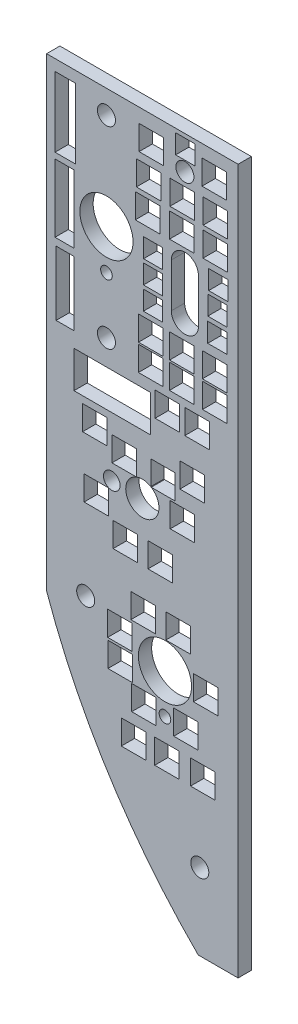
from build123d import *

# Parameters (mm, degrees)
BOSS_EXTRUDE1_DEPTH             = 3.175
F_1_2_0_5_DIAMETER_HOLE1_D      = 12.7
F_5_16_0_3125_DIAMETER_HOLE1_D  = 7.9375
F_5_32_0_15625_DIAMETER_HOLE1_D = 3.96875
F_7_64_0_10938_DIAMETER_HOLE1_D = 2.778252
F_6_CLEARANCE_HOLE1_D           = 4.3053
F_16_0_177_DIAMETER_HOLE1_D     = 4.4958
SKETCH16_W                      = 5.842
SKETCH16_H                      = 5.842
SKETCH16_W_2                    = 4.23392063
SKETCH16_H_2                    = 15.366349947
SKETCH16_W_3                    = 4.5021552
SKETCH16_H_3                    = 16.206338068
SKETCH16_W_4                    = 4.860523654
SKETCH16_H_4                    = 16.706116904
SKETCH16_W_5                    = 18.315310239
SKETCH16_H_5                    = 8.772069641
SKETCH16_W_6                    = 4.572
SKETCH16_H_6                    = 4.572
CUT_EXTRUDE5_DEPTH              = 149.577510685


with BuildPart() as part:
    # Sketch1 → Boss-Extrude1 (new body)
    with BuildSketch(Plane.XY):
        with BuildLine():
            Line((-45.72, 26.9875), (-45.72, -84.1375))
            ThreePointArc((-45.72, -84.1375), (-30.833523511, -114.746148224), (-9.525, -141.2875))
            Line((-9.525, -141.2875), (0, -141.2875))
            Line((0, -141.2875), (0, 26.9875))
            Line((0, 26.9875), (-45.72, 26.9875))
        make_face()
    extrude(amount=-BOSS_EXTRUDE1_DEPTH)

    # 1/2 (0.5) Diameter Hole1 (through all)
    with Locations(Plane.XY):
        with Locations((-17.4625, -86.5505), (-31.4325, -1.620345612)):
            Hole(F_1_2_0_5_DIAMETER_HOLE1_D / 2)

    # 5/16 (0.3125) Diameter Hole1 (through all)
    with Locations(Plane.XY):
        with Locations((-22.86, -53.5305)):
            Hole(F_5_16_0_3125_DIAMETER_HOLE1_D / 2)

    # 5/32 (0.15625) Diameter Hole1 (through all)
    with Locations(Plane.XY):
        with Locations((-30.161117219, -53.5305)):
            Hole(F_5_32_0_15625_DIAMETER_HOLE1_D / 2)

    # 7/64 (0.10938) Diameter Hole1 (through all)
    with Locations(Plane.XY):
        with Locations((-17.464635625, -95.966719242), (-31.4325, -11.158858051)):
            Hole(F_7_64_0_10938_DIAMETER_HOLE1_D / 2)

    # #6 Clearance Hole1 (through all)
    with Locations(Plane(origin=(0, 0, -3.175), x_dir=(-1, 0, 0), z_dir=(0, 0, -1))):
        with Locations((12.7, 19.05), (36.3855, -80.4545), (9.144, -122.9995), (31.4325, -24.620045612), (31.4325, 21.404754388)):
            Hole(F_6_CLEARANCE_HOLE1_D / 2)

    # #16 (0.177) Diameter Hole1 (through all)
    with Locations(Plane(origin=(0, 0, -3.175), x_dir=(-1, 0, 0), z_dir=(0, 0, -1))):
        with Locations((12.7, -11.284610784), (12.7, -0.780389216)):
            Hole(F_16_0_177_DIAMETER_HOLE1_D / 2)

    # Sketch16 → Cut-Extrude5 (cut, through all)
    with BuildSketch(Plane(origin=(0, 0, -4.775), x_dir=(-1, 0, 0), z_dir=(0, 0, -1))):
        with Locations((5.586877071, -25.056435986)):
            Rectangle(SKETCH16_W, SKETCH16_H)
        with Locations((13.472877071, -25.056435995)):
            Rectangle(SKETCH16_W, SKETCH16_H)
        with Locations((20.877877071, -25.056436004)):
            Rectangle(SKETCH16_W, SKETCH16_H)
        with Locations((20.852877078, -18.782436004)):
            Rectangle(SKETCH16_W, SKETCH16_H)
        with Locations((13.435877078, -18.757435995)):
            Rectangle(SKETCH16_W, SKETCH16_H)
        with Locations((5.612877078, -18.732435986)):
            Rectangle(SKETCH16_W, SKETCH16_H)
        with Locations((41.333495216, -19.347538251)):
            Rectangle(SKETCH16_W_2, SKETCH16_H_2)
        with Locations((41.467612501, -1.87219716)):
            Rectangle(SKETCH16_W_3, SKETCH16_H_3)
        with Locations((41.288428274, 15.966538328)):
            Rectangle(SKETCH16_W_4, SKETCH16_H_4)
        with Locations((9.803877062, -32.575435991)):
            Rectangle(SKETCH16_W, SKETCH16_H)
        with Locations((16.889877062, -32.524435999)):
            Rectangle(SKETCH16_W, SKETCH16_H)
        with Locations((8.429876979, -104.35563599)):
            Rectangle(SKETCH16_W, SKETCH16_H)
        with Locations((16.989876979, -104.329835999)):
            Rectangle(SKETCH16_W, SKETCH16_H)
        with Locations((24.967876979, -104.355236009)):
            Rectangle(SKETCH16_W, SKETCH16_H)
        with Locations((12.444876989, -96.049835994)):
            Rectangle(SKETCH16_W, SKETCH16_H)
        with Locations((22.477876989, -95.998636006)):
            Rectangle(SKETCH16_W, SKETCH16_H)
        with Locations((7.745877, -86.575635989)):
            Rectangle(SKETCH16_W, SKETCH16_H)
        with Locations((28.153876996, -89.902836012)):
            Rectangle(SKETCH16_W, SKETCH16_H)
        with Locations((28.216877004, -83.501836012)):
            Rectangle(SKETCH16_W, SKETCH16_H)
        with Locations((22.681877011, -77.075636006)):
            Rectangle(SKETCH16_W, SKETCH16_H)
        with Locations((14.322877011, -77.101435996)):
            Rectangle(SKETCH16_W, SKETCH16_H)
        with Locations((18.591877025, -64.528436001)):
            Rectangle(SKETCH16_W, SKETCH16_H)
        with Locations((26.922877025, -64.503036011)):
            Rectangle(SKETCH16_W, SKETCH16_H)
        with Locations((33.857877033, -58.330836019)):
            Rectangle(SKETCH16_W, SKETCH16_H)
        with Locations((13.280877038, -53.581035995)):
            Rectangle(SKETCH16_W, SKETCH16_H)
        with Locations((10.971877049, -44.208435993)):
            Rectangle(SKETCH16_W, SKETCH16_H)
        with Locations((17.931877045, -47.256436001)):
            Rectangle(SKETCH16_W, SKETCH16_H)
        with Locations((27.202877046, -46.900836011)):
            Rectangle(SKETCH16_W, SKETCH16_H)
        with Locations((34.212877049, -43.979836019)):
            Rectangle(SKETCH16_W, SKETCH16_H)
        with BuildLine():
            Line((9.460927119, -11.284610784), (9.460927119, -0.780389216))
            ThreePointArc((9.460927119, -0.780389216), (12.7, 2.458683665), (15.939072881, -0.780389216))
            Line((15.939072881, -0.780389216), (15.939072881, -11.284610784))
            ThreePointArc((15.939072881, -11.284610784), (12.7, -14.523683665), (9.460927119, -11.284610784))
        make_face()
        with Locations((30.03182465, -35.049313131)):
            Rectangle(SKETCH16_W_5, SKETCH16_H_5)
        with Locations((4.966877087, -11.380435986)):
            Rectangle(SKETCH16_W_6, SKETCH16_H_6)
        with Locations((4.951877093, -5.752435986)):
            Rectangle(SKETCH16_W_6, SKETCH16_H_6)
        with Locations((4.746877099, -0.368435985)):
            Rectangle(SKETCH16_W_6, SKETCH16_H_6)
        with Locations((5.459877107, 6.286564014)):
            Rectangle(SKETCH16_W, SKETCH16_H)
        with Locations((13.458877107, 6.235564005)):
            Rectangle(SKETCH16_W, SKETCH16_H)
        with Locations((21.625877107, 6.134563995)):
            Rectangle(SKETCH16_W, SKETCH16_H)
        with Locations((20.282877098, -1.550436003)):
            Rectangle(SKETCH16_W_6, SKETCH16_H_6)
        with Locations((20.307877092, -6.985436003)):
            Rectangle(SKETCH16_W_6, SKETCH16_H_6)
        with Locations((20.333877086, -12.421436003)):
            Rectangle(SKETCH16_W_6, SKETCH16_H_6)
        with Locations((5.406877115, 13.145564014)):
            Rectangle(SKETCH16_W, SKETCH16_H)
        with Locations((13.359877115, 13.068564005)):
            Rectangle(SKETCH16_W, SKETCH16_H)
        with Locations((21.360877115, 13.068563996)):
            Rectangle(SKETCH16_W, SKETCH16_H)
        with Locations((20.725877124, 20.688563996)):
            Rectangle(SKETCH16_W, SKETCH16_H)
        with Locations((5.686877124, 21.069564014)):
            Rectangle(SKETCH16_W, SKETCH16_H)
        with Locations((12.622877127, 23.761564006)):
            Rectangle(SKETCH16_W_6, SKETCH16_H_6)
    extrude(amount=-CUT_EXTRUDE5_DEPTH, mode=Mode.SUBTRACT)


solid = part.part
